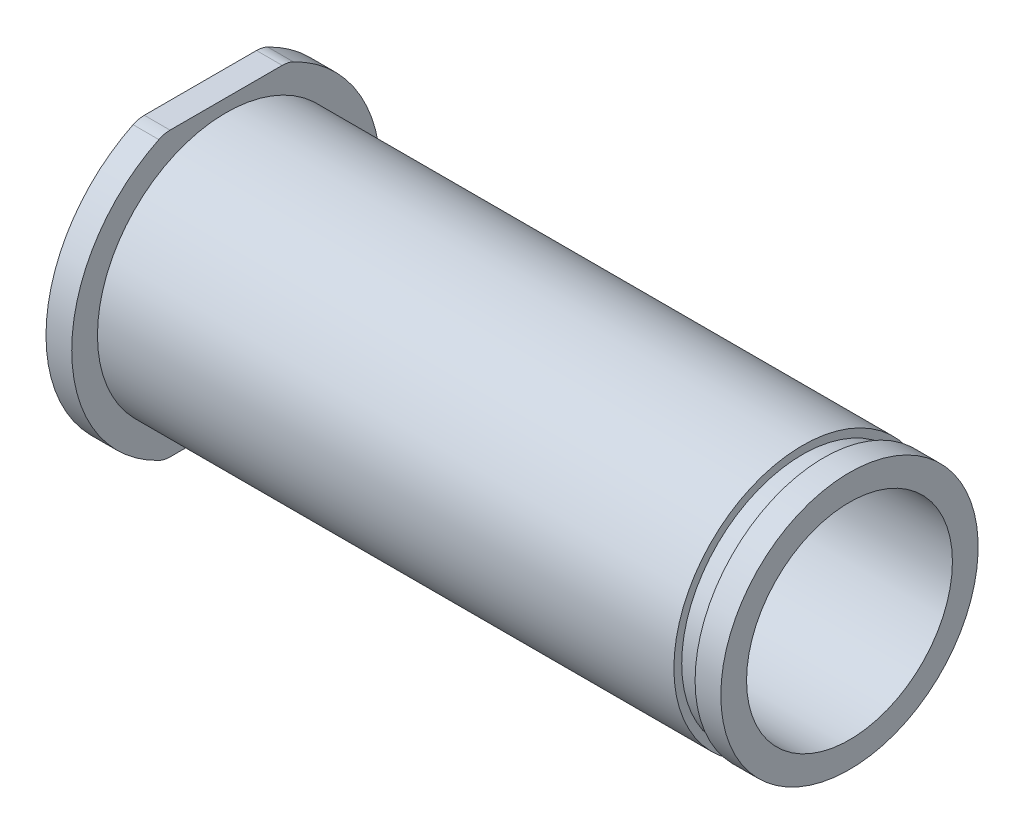
from build123d import *

# Parameters (mm, degrees)
SKETCH2_W          = 15.226765086
SKETCH2_H          = 1.5875
CUT_EXTRUDE1_DEPTH = 85.496179975
FILLET1_R          = 3.175


with BuildPart() as part:
    # Sketch1 → Revolve1 (revolve)
    with BuildSketch(Plane.XY):
        Polygon((0, 19.05), (0, 12.7), (80.0862, 12.7), (80.0862, 15.875), (76.9112, 15.875), (76.9112, 14.9098), (74.295, 14.9098), (74.295, 15.875), (3.175, 15.875), (3.175, 19.05), align=None)
    revolve(axis=Axis((0, 0, 0), (1, 0, 0)))

    # Sketch2 → Cut-Extrude1 (cut, through all)
    with BuildSketch(Plane.ZY):
        with Locations((0, 18.25625)):
            Rectangle(SKETCH2_W, SKETCH2_H)
        with Locations((0, -18.25625)):
            Rectangle(SKETCH2_W, SKETCH2_H)
    extrude(amount=-CUT_EXTRUDE1_DEPTH, mode=Mode.SUBTRACT)

    # Fillet1
    fillet1_edges = [part.edges().sort_by_distance(p)[0] for p in [
        (1.5875, -17.4625, -7.613382543),
        (1.5875, -17.4625, 7.613382543),
        (1.5875, 17.4625, 7.613382543),
        (1.5875, 17.4625, -7.613382543),
    ]]
    fillet(fillet1_edges, radius=FILLET1_R)


solid = part.part
